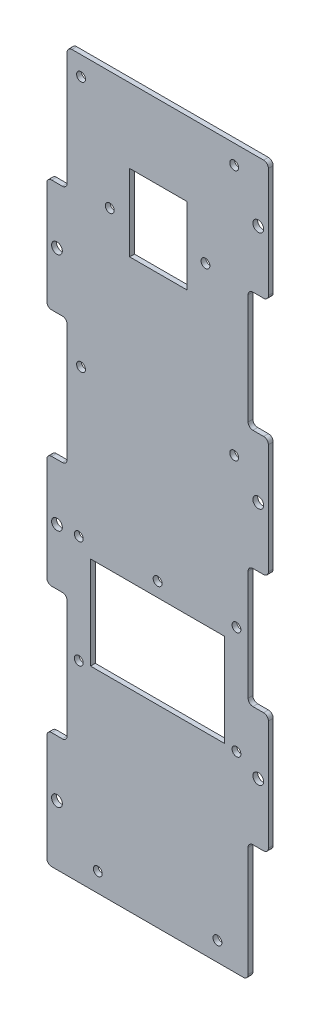
from build123d import *

# Parameters (mm, degrees)
SKETCH1_W           = 92.6
SKETCH1_H           = 300
BOSS_EXTRUDE1_DEPTH = 2
SKETCH2_R           = 2.25
SKETCH2_W           = 8.48
SKETCH2_H           = 51.5
SKETCH2_H_2         = 50
SKETCH2_H_3         = 53
CUT_EXTRUDE2_DEPTH  = 10
FILLET1_R           = 2
SKETCH3_R           = 1.85
CUT_EXTRUDE3_DEPTH  = 10
SKETCH4_R           = 1.85
SKETCH4_W           = 55.985713182
SKETCH4_H           = 38.778571429
CUT_EXTRUDE4_DEPTH  = 5
SKETCH5_R           = 1.85
SKETCH5_W           = 23.899789691
SKETCH5_H           = 32
CUT_EXTRUDE5_DEPTH  = 5


with BuildPart() as part:
    # Sketch1 → Boss-Extrude1 (new body)
    with BuildSketch(Plane.XY):
        Rectangle(SKETCH1_W, SKETCH1_H)
    extrude(amount=BOSS_EXTRUDE1_DEPTH)

    # Sketch2 → Cut-Extrude2 (cut)
    with BuildSketch(Plane.XY):
        with Locations((-42.06, 75)):
            Circle(SKETCH2_R)
        with Locations((42.06, 125)):
            Circle(SKETCH2_R)
        with Locations((42.06, 25)):
            Circle(SKETCH2_R)
        with Locations((42.06, -75)):
            Circle(SKETCH2_R)
        with Locations((-42.06, -25)):
            Circle(SKETCH2_R)
        with Locations((-42.06, -125)):
            Circle(SKETCH2_R)
        with Locations((-42.06, 124.25)):
            Rectangle(SKETCH2_W, SKETCH2_H)
        with Locations((42.06, 75)):
            Rectangle(SKETCH2_W, SKETCH2_H_2)
        with Locations((42.06, -25)):
            Rectangle(SKETCH2_W, SKETCH2_H_2)
        with Locations((-42.06, 25)):
            Rectangle(SKETCH2_W, SKETCH2_H_3)
        with Locations((-42.06, -75)):
            Rectangle(SKETCH2_W, SKETCH2_H_3)
        with Locations((42.06, -125)):
            Rectangle(SKETCH2_W, SKETCH2_H_2)
    extrude(amount=CUT_EXTRUDE2_DEPTH, mode=Mode.SUBTRACT)

    # Fillet1
    fillet1_edges = [part.edges().sort_by_distance(p)[0] for p in [
        (46.3, 50, 1),
        (37.82, 50, 1),
        (37.82, 100, 1),
        (46.3, 100, 1),
        (46.3, 150, 1),
        (-37.82, 150, 1),
        (-37.82, 98.5, 1),
        (-46.3, 98.5, 1),
        (-46.3, 51.5, 1),
        (-37.82, 51.5, 1),
        (-37.82, -1.5, 1),
        (-46.3, -1.5, 1),
        (-46.3, -48.5, 1),
        (-37.82, -48.5, 1),
        (-37.82, -101.5, 1),
        (-46.3, -101.5, 1),
        (-46.3, -150, 1),
        (37.82, -150, 1),
        (37.82, -100, 1),
        (46.3, -100, 1),
        (46.3, -50, 1),
        (37.82, -50, 1),
        (37.82, 0, 1),
        (46.3, 0, 1),
    ]]
    fillet(fillet1_edges, radius=FILLET1_R)

    # Sketch3 → Cut-Extrude3 (cut)
    with BuildSketch(Plane(origin=(0, 0, 0), x_dir=(-1, 0, 0), z_dir=(0, 0, -1))):
        with Locations((-25, -142)):
            Circle(SKETCH3_R)
        with Locations((25, -142)):
            Circle(SKETCH3_R)
        with Locations((-32, 142)):
            Circle(SKETCH3_R)
        with Locations((32, 142)):
            Circle(SKETCH3_R)
    extrude(amount=-CUT_EXTRUDE3_DEPTH, mode=Mode.SUBTRACT)

    # Sketch4 → Cut-Extrude4 (cut)
    with BuildSketch(Plane(origin=(0, 0, 0), x_dir=(-1, 0, 0), z_dir=(0, 0, -1))):
        with Locations((-32.95, -24.767949192)):
            Circle(SKETCH4_R)
        with Locations((0, -24.5)):
            Circle(SKETCH4_R)
        with Locations((32.95, -24.767949192)):
            Circle(SKETCH4_R)
        with Locations((-32.95, -69.732050808)):
            Circle(SKETCH4_R)
        with Locations((32.95, -69.732050808)):
            Circle(SKETCH4_R)
        with Locations((0.042856591, -49.889285715)):
            Rectangle(SKETCH4_W, SKETCH4_H)
    extrude(amount=-CUT_EXTRUDE4_DEPTH, mode=Mode.SUBTRACT)

    # Sketch5 → Cut-Extrude5 (cut)
    with BuildSketch(Plane(origin=(0, 0, 0), x_dir=(-1, 0, 0), z_dir=(0, 0, -1))):
        with Locations((-20, 100.5)):
            Circle(SKETCH5_R)
        with Locations((20, 100.5)):
            Circle(SKETCH5_R)
        with Locations((32, 37)):
            Circle(SKETCH5_R)
        with Locations((-32, 37)):
            Circle(SKETCH5_R)
        with Locations((-0.26347569, 103)):
            Rectangle(SKETCH5_W, SKETCH5_H)
    extrude(amount=-CUT_EXTRUDE5_DEPTH, mode=Mode.SUBTRACT)


solid = part.part
